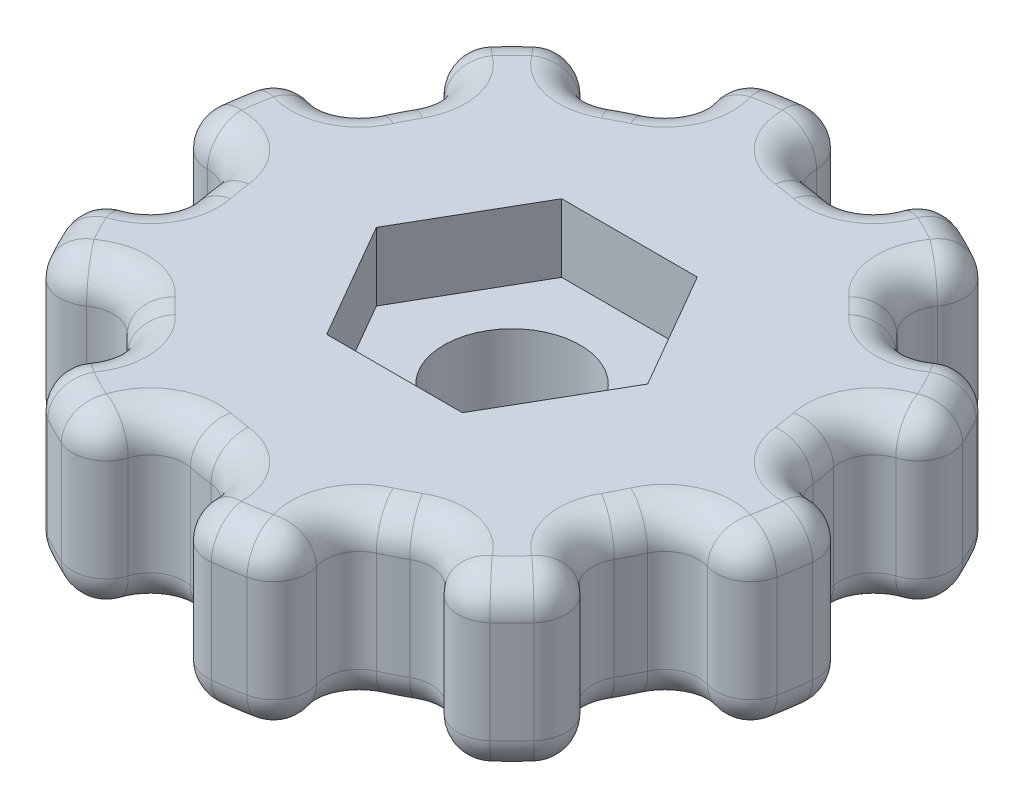
from build123d import *

# Parameters (mm, degrees)
CROQUIS1_R              = 10
SALIENTE_EXTRUIR1_DEPTH = 5
CORTAR_EXTRUIR1_REACH   = 17
REDONDEO1_R             = 1
REDONDEO2_R             = 1
CORTAR_EXTRUIR2_DEPTH   = 2
CROQUIS4_R              = 2
CORTAR_EXTRUIR3_DEPTH   = 15.92573476


with BuildPart() as part:
    # Croquis1 → Saliente-Extruir1 (new body)
    with BuildSketch(Plane(origin=(0, 0, 0), x_dir=(1, 0, 0), z_dir=(0, 1, 0))):
        with Locations(Location((0, 0, 0), (0, 0, 270))):
            Circle(CROQUIS1_R)
    extrude(amount=SALIENTE_EXTRUIR1_DEPTH)

    # Croquis2 → Cortar-Extruir1 (cut, up to next)
    with BuildSketch(Plane(origin=(0, 5, 0), x_dir=(1, 0, 0), z_dir=(0, 1, 0)), mode=Mode.PRIVATE) as cortar_extruir1_sk1:
        with BuildLine():
            Line((0, 8), (0, 10))
            ThreePointArc((0, 10), (1.56434465, 9.876883406), (3.090169944, 9.510565163))
            Line((3.090169944, 9.510565163), (2.472135955, 7.60845213))
            ThreePointArc((2.472135955, 7.60845213), (1.25147572, 7.901506725), (0, 8))
        make_face()
    cortar_extruir1_tool1 = extrude(cortar_extruir1_sk1.sketch, amount=-CORTAR_EXTRUIR1_REACH, mode=Mode.PRIVATE) & part.part
    # Croquis2 → Cortar-Extruir1 (cut, up to next)
    with BuildSketch(Plane(origin=(0, 5, 0), x_dir=(1, 0, 0), z_dir=(0, 1, 0)), mode=Mode.PRIVATE) as cortar_extruir1_sk2:
        with BuildLine():
            Line((4.702282018, 6.472135955), (5.877852523, 8.090169944))
            ThreePointArc((5.877852523, 8.090169944), (7.071067812, 7.071067812), (8.090169944, 5.877852523))
            Line((8.090169944, 5.877852523), (6.472135955, 4.702282018))
            ThreePointArc((6.472135955, 4.702282018), (5.656854249, 5.656854249), (4.702282018, 6.472135955))
        make_face()
    cortar_extruir1_tool2 = extrude(cortar_extruir1_sk2.sketch, amount=-CORTAR_EXTRUIR1_REACH, mode=Mode.PRIVATE) & part.part
    # Croquis2 → Cortar-Extruir1 (cut, up to next)
    with BuildSketch(Plane(origin=(0, 5, 0), x_dir=(1, 0, 0), z_dir=(0, 1, 0)), mode=Mode.PRIVATE) as cortar_extruir1_sk3:
        with BuildLine():
            Line((7.60845213, 2.472135955), (9.510565163, 3.090169944))
            ThreePointArc((9.510565163, 3.090169944), (9.876883406, 1.56434465), (10, 0))
            Line((10, 0), (8, 0))
            ThreePointArc((8, 0), (7.901506725, 1.25147572), (7.60845213, 2.472135955))
        make_face()
    cortar_extruir1_tool3 = extrude(cortar_extruir1_sk3.sketch, amount=-CORTAR_EXTRUIR1_REACH, mode=Mode.PRIVATE) & part.part
    # Croquis2 → Cortar-Extruir1 (cut, up to next)
    with BuildSketch(Plane(origin=(0, 5, 0), x_dir=(1, 0, 0), z_dir=(0, 1, 0)), mode=Mode.PRIVATE) as cortar_extruir1_sk4:
        with BuildLine():
            Line((7.60845213, -2.472135955), (9.510565163, -3.090169944))
            ThreePointArc((9.510565163, -3.090169944), (8.910065242, -4.539904997), (8.090169944, -5.877852523))
            Line((8.090169944, -5.877852523), (6.472135955, -4.702282018))
            ThreePointArc((6.472135955, -4.702282018), (7.128052194, -3.631923998), (7.60845213, -2.472135955))
        make_face()
    cortar_extruir1_tool4 = extrude(cortar_extruir1_sk4.sketch, amount=-CORTAR_EXTRUIR1_REACH, mode=Mode.PRIVATE) & part.part
    # Croquis2 → Cortar-Extruir1 (cut, up to next)
    with BuildSketch(Plane(origin=(0, 5, 0), x_dir=(1, 0, 0), z_dir=(0, 1, 0)), mode=Mode.PRIVATE) as cortar_extruir1_sk5:
        with BuildLine():
            Line((4.702282018, -6.472135955), (5.877852523, -8.090169944))
            ThreePointArc((5.877852523, -8.090169944), (4.539904997, -8.910065242), (3.090169944, -9.510565163))
            Line((3.090169944, -9.510565163), (2.472135955, -7.60845213))
            ThreePointArc((2.472135955, -7.60845213), (3.631923998, -7.128052194), (4.702282018, -6.472135955))
        make_face()
    cortar_extruir1_tool5 = extrude(cortar_extruir1_sk5.sketch, amount=-CORTAR_EXTRUIR1_REACH, mode=Mode.PRIVATE) & part.part
    # Croquis2 → Cortar-Extruir1 (cut, up to next)
    with BuildSketch(Plane(origin=(0, 5, 0), x_dir=(1, 0, 0), z_dir=(0, 1, 0)), mode=Mode.PRIVATE) as cortar_extruir1_sk6:
        with BuildLine():
            Line((0, -8), (0, -10))
            ThreePointArc((0, -10), (-1.56434465, -9.876883406), (-3.090169944, -9.510565163))
            Line((-3.090169944, -9.510565163), (-2.472135955, -7.60845213))
            ThreePointArc((-2.472135955, -7.60845213), (-1.25147572, -7.901506725), (0, -8))
        make_face()
    cortar_extruir1_tool6 = extrude(cortar_extruir1_sk6.sketch, amount=-CORTAR_EXTRUIR1_REACH, mode=Mode.PRIVATE) & part.part
    # Croquis2 → Cortar-Extruir1 (cut, up to next)
    with BuildSketch(Plane(origin=(0, 5, 0), x_dir=(1, 0, 0), z_dir=(0, 1, 0)), mode=Mode.PRIVATE) as cortar_extruir1_sk7:
        with BuildLine():
            Line((-4.702282018, -6.472135955), (-5.877852523, -8.090169944))
            ThreePointArc((-5.877852523, -8.090169944), (-7.071067812, -7.071067812), (-8.090169944, -5.877852523))
            Line((-8.090169944, -5.877852523), (-6.472135955, -4.702282018))
            ThreePointArc((-6.472135955, -4.702282018), (-5.656854249, -5.656854249), (-4.702282018, -6.472135955))
        make_face()
    cortar_extruir1_tool7 = extrude(cortar_extruir1_sk7.sketch, amount=-CORTAR_EXTRUIR1_REACH, mode=Mode.PRIVATE) & part.part
    # Croquis2 → Cortar-Extruir1 (cut, up to next)
    with BuildSketch(Plane(origin=(0, 5, 0), x_dir=(1, 0, 0), z_dir=(0, 1, 0)), mode=Mode.PRIVATE) as cortar_extruir1_sk8:
        with BuildLine():
            Line((-7.60845213, -2.472135955), (-9.510565163, -3.090169944))
            ThreePointArc((-9.510565163, -3.090169944), (-9.876883406, -1.56434465), (-10, 0))
            Line((-10, 0), (-8, 0))
            ThreePointArc((-8, 0), (-7.901506725, -1.25147572), (-7.60845213, -2.472135955))
        make_face()
    cortar_extruir1_tool8 = extrude(cortar_extruir1_sk8.sketch, amount=-CORTAR_EXTRUIR1_REACH, mode=Mode.PRIVATE) & part.part
    # Croquis2 → Cortar-Extruir1 (cut, up to next)
    with BuildSketch(Plane(origin=(0, 5, 0), x_dir=(1, 0, 0), z_dir=(0, 1, 0)), mode=Mode.PRIVATE) as cortar_extruir1_sk9:
        with BuildLine():
            Line((-7.60845213, 2.472135955), (-9.510565163, 3.090169944))
            ThreePointArc((-9.510565163, 3.090169944), (-8.910065242, 4.539904997), (-8.090169944, 5.877852523))
            Line((-8.090169944, 5.877852523), (-6.472135955, 4.702282018))
            ThreePointArc((-6.472135955, 4.702282018), (-7.128052194, 3.631923998), (-7.60845213, 2.472135955))
        make_face()
    cortar_extruir1_tool9 = extrude(cortar_extruir1_sk9.sketch, amount=-CORTAR_EXTRUIR1_REACH, mode=Mode.PRIVATE) & part.part
    # Croquis2 → Cortar-Extruir1 (cut, up to next)
    with BuildSketch(Plane(origin=(0, 5, 0), x_dir=(1, 0, 0), z_dir=(0, 1, 0)), mode=Mode.PRIVATE) as cortar_extruir1_sk10:
        with BuildLine():
            Line((-4.702282018, 6.472135955), (-5.877852523, 8.090169944))
            ThreePointArc((-5.877852523, 8.090169944), (-4.539904997, 8.910065242), (-3.090169944, 9.510565163))
            Line((-3.090169944, 9.510565163), (-2.472135955, 7.60845213))
            ThreePointArc((-2.472135955, 7.60845213), (-3.631923998, 7.128052194), (-4.702282018, 6.472135955))
        make_face()
    cortar_extruir1_tool10 = extrude(cortar_extruir1_sk10.sketch, amount=-CORTAR_EXTRUIR1_REACH, mode=Mode.PRIVATE) & part.part
    add(cortar_extruir1_tool1.solids().sort_by_distance((1.407898, 5, -8.889116))[0], mode=Mode.SUBTRACT)
    add(cortar_extruir1_tool2.solids().sort_by_distance((6.363904, 5, -6.363904))[0], mode=Mode.SUBTRACT)
    add(cortar_extruir1_tool3.solids().sort_by_distance((8.889116, 5, -1.407898))[0], mode=Mode.SUBTRACT)
    add(cortar_extruir1_tool4.solids().sort_by_distance((8.018987, 5, 4.085878))[0], mode=Mode.SUBTRACT)
    add(cortar_extruir1_tool5.solids().sort_by_distance((4.085878, 5, 8.018987))[0], mode=Mode.SUBTRACT)
    add(cortar_extruir1_tool6.solids().sort_by_distance((-1.407898, 5, 8.889116))[0], mode=Mode.SUBTRACT)
    add(cortar_extruir1_tool7.solids().sort_by_distance((-6.363904, 5, 6.363904))[0], mode=Mode.SUBTRACT)
    add(cortar_extruir1_tool8.solids().sort_by_distance((-8.889116, 5, 1.407898))[0], mode=Mode.SUBTRACT)
    add(cortar_extruir1_tool9.solids().sort_by_distance((-8.018987, 5, -4.085878))[0], mode=Mode.SUBTRACT)
    add(cortar_extruir1_tool10.solids().sort_by_distance((-4.085878, 5, -8.018987))[0], mode=Mode.SUBTRACT)

    # Redondeo1
    redondeo1_edges = [part.edges().sort_by_distance(p)[0] for p in [
        (-4.702282018, 2.5, -6.472135955),
        (-5.877852523, 2.5, -8.090169944),
        (-6.472135955, 2.5, -4.702282018),
        (-8.090169944, 2.5, -5.877852523),
        (-7.60845213, 2.5, -2.472135955),
        (-9.510565163, 2.5, -3.090169944),
        (-8, 2.5, 0),
        (-10, 2.5, 0),
        (-7.60845213, 2.5, 2.472135955),
        (-9.510565163, 2.5, 3.090169944),
        (-8.090169944, 2.5, 5.877852523),
        (-6.472135955, 2.5, 4.702282018),
        (-4.702282018, 2.5, 6.472135955),
        (-5.877852523, 2.5, 8.090169944),
        (0, 2.5, 8),
        (-3.090169944, 2.5, 9.510565163),
        (-2.472135955, 2.5, 7.60845213),
        (0, 2.5, 10),
        (3.090169944, 2.5, 9.510565163),
        (2.472135955, 2.5, 7.60845213),
        (4.702282018, 2.5, 6.472135955),
        (5.877852523, 2.5, 8.090169944),
        (8.090169944, 2.5, 5.877852523),
        (7.60845213, 2.5, 2.472135955),
        (6.472135955, 2.5, 4.702282018),
        (9.510565163, 2.5, 3.090169944),
        (10, 2.5, 0),
        (8, 2.5, 0),
        (7.60845213, 2.5, -2.472135955),
        (9.510565163, 2.5, -3.090169944),
        (6.472135955, 2.5, -4.702282018),
        (4.702282018, 2.5, -6.472135955),
        (5.877852523, 2.5, -8.090169944),
        (3.090169944, 2.5, -9.510565163),
        (2.472135955, 2.5, -7.60845213),
        (0, 2.5, -8),
        (0, 2.5, -10),
        (-3.090169944, 2.5, -9.510565163),
        (-2.472135955, 2.5, -7.60845213),
        (8.090169944, 2.5, -5.877852523),
    ]]
    fillet(redondeo1_edges, radius=REDONDEO1_R - 0.0001)  # a hair under: the kernel refuses the full size

    # Redondeo2
    redondeo2_edges = [part.edges().sort_by_distance(p)[0] for p in [
        (8.910065242, 5, -4.539904997),
        (8.910065242, 0, -4.539904997),
        (-7.071067812, 5, -7.071067812),
        (-7.128052194, 5, -3.631923998),
        (-9.876883406, 5, -1.56434465),
        (-7.901506725, 5, 1.25147572),
        (-8.910065242, 5, 4.539904997),
        (-5.656854249, 5, 5.656854249),
        (-4.539904997, 5, 8.910065242),
        (-1.25147572, 5, 7.901506725),
        (1.56434465, 5, 9.876883406),
        (3.631923998, 5, 7.128052194),
        (7.071067812, 5, 7.071067812),
        (7.128052194, 5, 3.631923998),
        (9.876883406, 5, 1.56434465),
        (7.901506725, 5, -1.25147572),
        (5.656854249, 5, -5.656854249),
        (4.539904997, 5, -8.910065242),
        (1.25147572, 5, -7.901506725),
        (-1.56434465, 5, -9.876883406),
        (-3.631923998, 5, -7.128052194),
        (-2.677287193, 5, -9.318409196),
        (-0.333295371, 5, -9.689661029),
        (3.311252662, 5, -9.112421329),
        (5.425798233, 5, -8.035006546),
        (9.112421329, 5, -3.311252662),
        (9.689661029, 5, 0.333295371),
        (9.318409196, 5, 2.677287193),
        (7.643194339, 5, 5.965081472),
        (5.965081472, 5, 7.643194339),
        (2.677287193, 5, 9.318409196),
        (0.333295371, 5, 9.689661029),
        (-3.311252662, 5, 9.112421329),
        (-5.425798233, 5, 8.035006546),
        (-8.035006546, 5, 5.425798233),
        (-9.112421329, 5, 3.311252662),
        (-9.689661029, 5, -0.333295371),
        (-9.318409196, 5, -2.677287193),
        (-7.643194339, 5, -5.965081472),
        (-5.965081472, 5, -7.643194339),
        (8.035006546, 5, -5.425798233),
        (-7.071067812, 0, -7.071067812),
        (-3.631923998, 0, -7.128052194),
        (-1.56434465, 0, -9.876883406),
        (1.25147572, 0, -7.901506725),
        (4.539904997, 0, -8.910065242),
        (5.656854249, 0, -5.656854249),
        (7.901506725, 0, -1.25147572),
        (9.876883406, 0, 1.56434465),
        (7.128052194, 0, 3.631923998),
        (7.071067812, 0, 7.071067812),
        (3.631923998, 0, 7.128052194),
        (1.56434465, 0, 9.876883406),
        (-1.25147572, 0, 7.901506725),
        (-4.539904997, 0, 8.910065242),
        (-5.656854249, 0, 5.656854249),
        (-8.910065242, 0, 4.539904997),
        (-7.901506725, 0, 1.25147572),
        (-9.876883406, 0, -1.56434465),
        (-7.128052194, 0, -3.631923998),
        (-2.677287193, 0, -9.318409196),
        (-0.333295371, 0, -9.689661029),
        (3.311252662, 0, -9.112421329),
        (5.425798233, 0, -8.035006546),
        (9.112421329, 0, -3.311252662),
        (9.689661029, 0, 0.333295371),
        (9.318409196, 0, 2.677287193),
        (7.643194339, 0, 5.965081472),
        (5.965081472, 0, 7.643194339),
        (2.677287193, 0, 9.318409196),
        (0.333295371, 0, 9.689661029),
        (-3.311252662, 0, 9.112421329),
        (-5.425798233, 0, 8.035006546),
        (-8.035006546, 0, 5.425798233),
        (-9.112421329, 0, 3.311252662),
        (-9.689661029, 0, -0.333295371),
        (-9.318409196, 0, -2.677287193),
        (-7.643194339, 0, -5.965081472),
        (-5.965081472, 0, -7.643194339),
        (8.035006546, 0, -5.425798233),
        (-4.659445314, 5, -6.846364864),
        (-4.659445314, 0, -6.846364864),
        (-6.846364864, 5, -4.659445314),
        (-6.846364864, 0, -4.659445314),
        (-7.793762742, 5, -2.800072285),
        (-7.793762742, 0, -2.800072285),
        (-8.277578763, 5, 0.254621856),
        (-8.277578763, 0, 0.254621856),
        (-7.951127703, 5, 2.315752735),
        (-7.951127703, 0, 2.315752735),
        (-6.54703892, 5, 5.07143213),
        (-6.54703892, 0, 5.07143213),
        (-5.07143213, 5, 6.54703892),
        (-5.07143213, 0, 6.54703892),
        (-0.254621856, 5, 8.277578763),
        (-0.254621856, 0, 8.277578763),
        (-2.315752735, 5, 7.951127703),
        (-2.315752735, 0, 7.951127703),
        (2.800072285, 5, 7.793762742),
        (2.800072285, 0, 7.793762742),
        (4.659445314, 5, 6.846364864),
        (4.659445314, 0, 6.846364864),
        (7.793762742, 5, 2.800072285),
        (7.793762742, 0, 2.800072285),
        (6.846364864, 5, 4.659445314),
        (6.846364864, 0, 4.659445314),
        (8.277578763, 5, -0.254621856),
        (8.277578763, 0, -0.254621856),
        (7.951127703, 5, -2.315752735),
        (7.951127703, 0, -2.315752735),
        (6.54703892, 5, -5.07143213),
        (6.54703892, 0, -5.07143213),
        (5.07143213, 5, -6.54703892),
        (5.07143213, 0, -6.54703892),
        (2.315752735, 5, -7.951127703),
        (2.315752735, 0, -7.951127703),
        (0.254621856, 5, -8.277578763),
        (0.254621856, 0, -8.277578763),
        (-2.800072285, 5, -7.793762742),
        (-2.800072285, 0, -7.793762742),
    ]]
    fillet(redondeo2_edges, radius=REDONDEO2_R - 0.0001)  # a hair under: the kernel refuses the full size

    # Croquis3 → Cortar-Extruir2 (cut)
    with BuildSketch(Plane(origin=(0, 5, 0), x_dir=(1, 0, 0), z_dir=(0, 1, 0))):
        Polygon((-1.991858429, 3.45), (-3.983716857, 0), (-1.991858429, -3.45), (1.991858429, -3.45), (3.983716857, 0), (1.991858429, 3.45), align=None)
    extrude(amount=-CORTAR_EXTRUIR2_DEPTH, mode=Mode.SUBTRACT)

    # Croquis4 → Cortar-Extruir3 (cut, through all)
    with BuildSketch(Plane(origin=(0, 5, 0), x_dir=(1, 0, 0), z_dir=(0, 1, 0))):
        with Locations(Location((0, 0, 0), (0, 0, 270))):
            Circle(CROQUIS4_R)
    extrude(amount=-CORTAR_EXTRUIR3_DEPTH, mode=Mode.SUBTRACT)


solid = part.part
